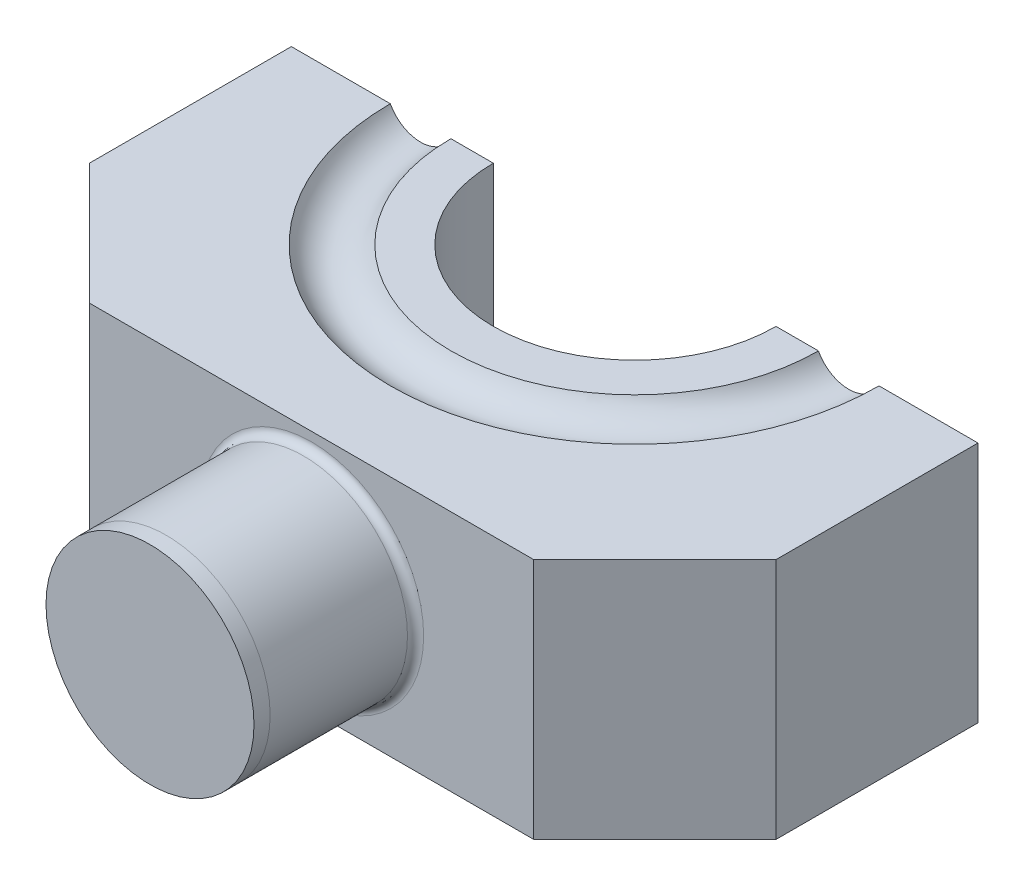
from build123d import *

# Parameters (mm, degrees)
MAIN_DEPTH              = 120
PERNO1_START            = 160
PERNO1_OUTLINE_R        = 51.5
PERNO1_DEPTH            = 80
PERNO1_2_OUTLINE_R      = 70
PERNO1_2_DEPTH          = 120
FILLET2_R               = 4
FILLET2_OF_MIRROR14_R   = 4
CHAMFER2_SIZE           = 5
PISTA_R                 = 17
CUT_EXTRUDE1_DEPTH      = 318.647603485
CUT_EXTRUDE1_DEPTH_BACK = 318.647603485
SKETCH12_W              = 447.780773858
SKETCH12_H              = 289.463518693


# Read off the part's stored shape, not the designer's step: Perno1
with BuildPart() as part:
    # MainBody → Main (new body)
    with BuildSketch(Plane(origin=(0, 0, 0), x_dir=(1, 0, 0), z_dir=(0, 1, 0))):
        Polygon((-110, 160), (110, 160), (170, 100), (170, -100), (110, -160), (-110, -160), (-170, -100), (-170, 100), align=None)
    extrude(amount=MAIN_DEPTH)

    # Perno1 outline → Perno1 (add)
    with BuildSketch(Plane.XY.offset(PERNO1_START)):
        with Locations((0, 60)):
            Circle(PERNO1_OUTLINE_R)
    perno1 = extrude(amount=PERNO1_DEPTH)

    # Perno1 2 outline → Perno1 2 (cut)
    with BuildSketch(Plane(origin=(0, 0, 0), x_dir=(1, 0, 0), z_dir=(0, 1, 0))):
        Circle(PERNO1_2_OUTLINE_R)
    perno1_2 = extrude(amount=PERNO1_2_DEPTH, mode=Mode.SUBTRACT)

    # Fillet2
    fillet2_edges = [part.edges().sort_by_distance(p)[0] for p in [
        (-51.5, 60, 160),
    ]]
    fillet(fillet2_edges, radius=FILLET2_R)

    # Mirror14: Perno1, Perno1 2 across plane
    add(perno1.mirror(Plane.XY))
    add(perno1_2.mirror(Plane.XY), mode=Mode.SUBTRACT)

    # Fillet2 of Mirror14
    fillet2_of_mirror14_edges = [part.edges().sort_by_distance(p)[0] for p in [
        (-51.5, 60, -160),
    ]]
    fillet(fillet2_of_mirror14_edges, radius=FILLET2_OF_MIRROR14_R)

    # Chamfer2
    chamfer2_edges = [part.edges().sort_by_distance(p)[0] for p in [
        (-70, 0, 0),
    ]]
    chamfer(chamfer2_edges, length=CHAMFER2_SIZE)

    # Pista → PistaCut (revolve, cut)
    with BuildSketch(Plane.XY, mode=Mode.PRIVATE) as pistacut_sk:
        with Locations((106, 128)):
            Circle(PISTA_R)
    revolve(pistacut_sk.sketch.rotate(Axis((0, 120, 0), (0, -1, 0)), 90), axis=Axis((0, 120, 0), (0, -1, 0)), mode=Mode.SUBTRACT)

    # Sketch12 → Cut-Extrude1 (cut, two sides: drawn at the far end of the back side and taken through both)
    with BuildSketch(Plane(origin=(0, 0, 0), x_dir=(1, 0, 0), z_dir=(0, 1, 0)).offset(-CUT_EXTRUDE1_DEPTH_BACK)):
        with Locations((7.371920004, 144.731759347)):
            Rectangle(SKETCH12_W, SKETCH12_H)
    extrude(amount=CUT_EXTRUDE1_DEPTH + CUT_EXTRUDE1_DEPTH_BACK, mode=Mode.SUBTRACT)


solid = part.part
